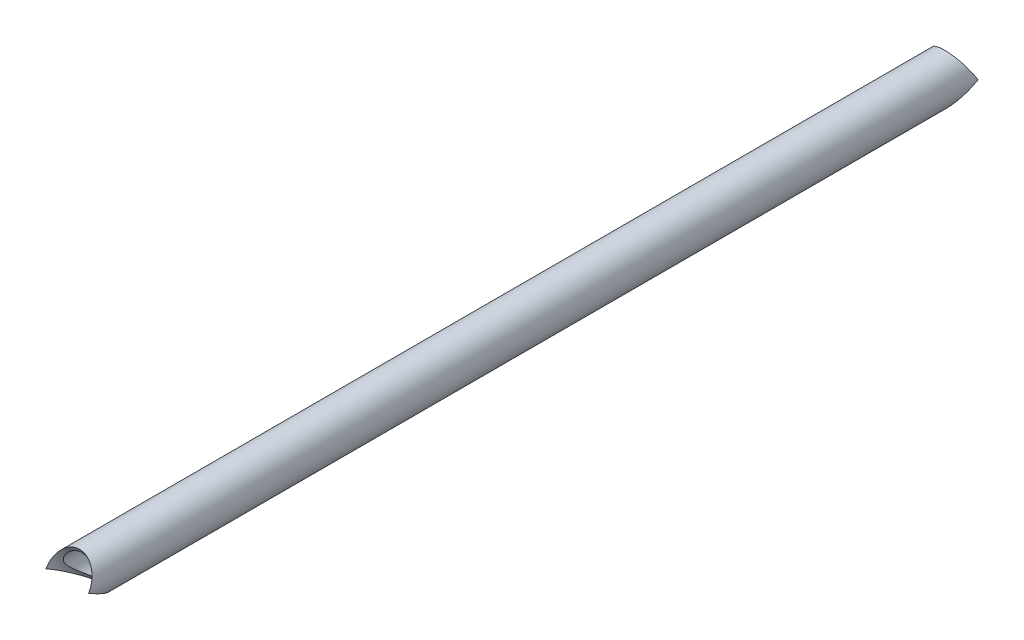
from build123d import *

# Parameters (mm, degrees)
EXTRUDE_START         = -221.925609917
EXTRUDE_1_OUTLINE_R   = 10.65
EXTRUDE_1_OUTLINE_R_2 = 8.65
EXTRUDE_1_DEPTH       = 221.925609917
EXTRUDE_START_2       = 87
EXTRUDE_1_2_DEPTH     = 30


with BuildPart() as part:
    # Бобышка-Вытянуть1: read off the stored shape, not the designer's step
    # Бобышка-Вытянуть1 outline → Бобышка-Вытянуть1 (new body)
    with BuildSketch(Plane.XY.offset(EXTRUDE_START)):
        with Locations((0, -5.325)):
            Circle(EXTRUDE_1_OUTLINE_R)
        with Locations((0, -5.325)):
            Circle(EXTRUDE_1_OUTLINE_R_2, mode=Mode.SUBTRACT)
    extrude(amount=EXTRUDE_1_DEPTH)

    # Extrude 1 2 outline → Extrude 1 2 (cut)
    with BuildSketch(Plane(origin=(0, 0, 0), x_dir=(1, 0, 0), z_dir=(0, 0.8660254037845095, -0.4999999999998773)).offset(EXTRUDE_START_2)):
        with BuildLine():
            ThreePointArc((-10.65, 194.855715851), (0, 184.205715851), (10.65, 194.855715851))
            Line((10.65, 194.855715851), (10.65, 202))
            Line((10.65, 202), (-10.65, 202))
            Line((-10.65, 202), (-10.65, 194.855715851))
        make_face()
    extrude(amount=EXTRUDE_1_2_DEPTH, mode=Mode.SUBTRACT)

    # Зеркальное отражение1: part across plane


with BuildPart() as part_1:
    add(part.part)
    add(part.part.mirror(Plane(origin=(0, -5.325, 0), x_dir=(1, 0, 0), z_dir=(0, 0, 1))))


solid = part_1.part
